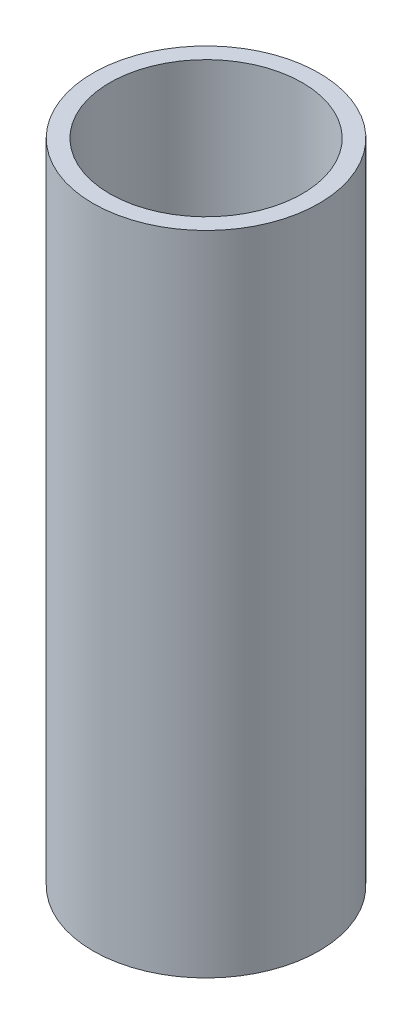
from build123d import *

# Parameters (mm, degrees)
SKETCH1_R           = 25
BOSS_EXTRUDE1_DEPTH = 143.192905409
SKETCH2_R           = 21.29667607
CUT_EXTRUDE1_DEPTH  = 148.493078345


with BuildPart() as part:
    # Sketch1 → Boss-Extrude1 (new body)
    with BuildSketch(Plane(origin=(0, 0, 0), x_dir=(1, 0, 0), z_dir=(0, 1, 0))):
        Circle(SKETCH1_R)
    extrude(amount=BOSS_EXTRUDE1_DEPTH)

    # Sketch2 → Cut-Extrude1 (cut, through all)
    with BuildSketch(Plane(origin=(0, 0, 0), x_dir=(1, 0, 0), z_dir=(0, 1, 0))):
        Circle(SKETCH2_R)
    extrude(amount=CUT_EXTRUDE1_DEPTH, mode=Mode.SUBTRACT)


solid = part.part
